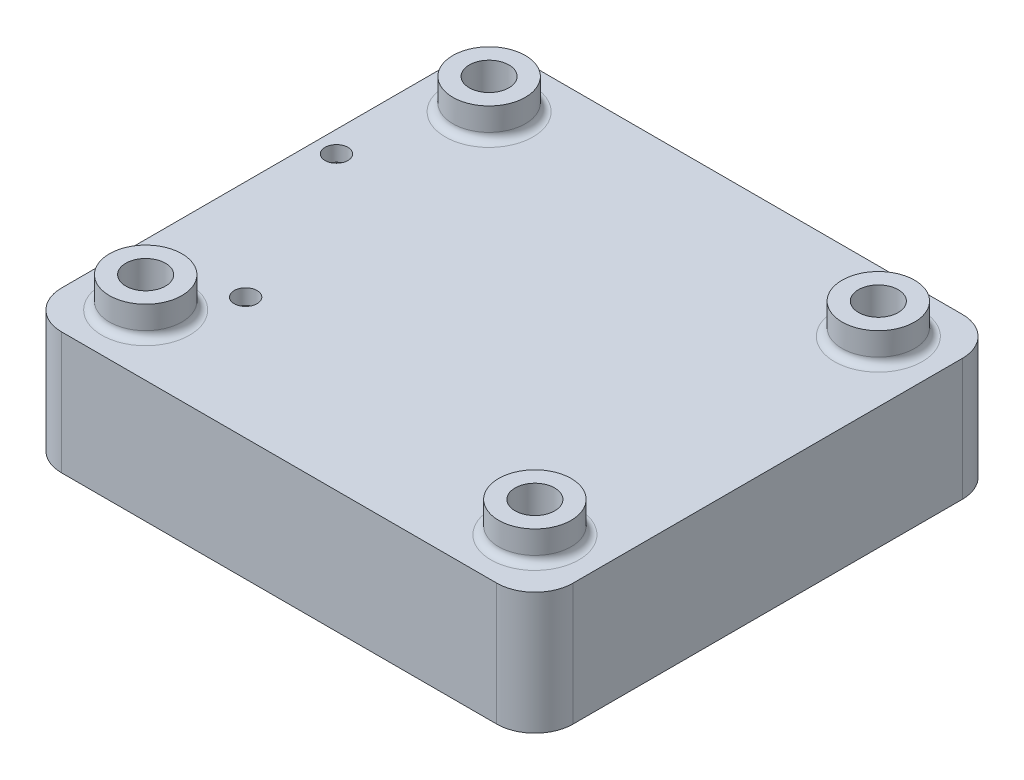
from build123d import *

# Parameters (mm, degrees)
ESQUISSE1_W             = 67
ESQUISSE1_H             = 61
BOSS_EXTRU_1_DEPTH      = 16
ESQUISSE4_R             = 4.75
BOSS_EXTRU_3_DEPTH      = 4
ESQUISSE6_R             = 2.6
ENL_V_MAT_EXTRU_2_DEPTH = 93.790085677
CONG_2_R                = 1
CONG_3_R                = 5
ENL_V_MAT_EXTRU_3_DEPTH = 14
ESQUISSE8_R             = 1.5
ENL_V_MAT_EXTRU_4_DEPTH = 11


with BuildPart() as part:
    # Esquisse1 → Boss.-Extru.1 (new body)
    with BuildSketch(Plane(origin=(0, 0, 0), x_dir=(1, 0, 0), z_dir=(0, 1, 0))):
        with Locations((33.5, 30.5)):
            Rectangle(ESQUISSE1_W, ESQUISSE1_H)
    extrude(amount=BOSS_EXTRU_1_DEPTH)

    # Esquisse4 → Boss.-Extru.3 (add)
    with BuildSketch(Plane(origin=(0, 16, 0), x_dir=(1, 0, 0), z_dir=(0, 1, 0))):
        with Locations((8, 8)):
            Circle(ESQUISSE4_R)
        with Locations((8, 53)):
            Circle(ESQUISSE4_R)
        with Locations((59, 8)):
            Circle(ESQUISSE4_R)
        with Locations((59, 53)):
            Circle(ESQUISSE4_R)
    extrude(amount=BOSS_EXTRU_3_DEPTH)

    # Esquisse6 → Enlèv. mat.-Extru.2 (cut, through all)
    with BuildSketch(Plane(origin=(0, 20, 0), x_dir=(1, 0, 0), z_dir=(0, 1, 0))):
        with Locations((8, 8)):
            Circle(ESQUISSE6_R)
        with Locations((8, 53)):
            Circle(ESQUISSE6_R)
        with Locations((59, 53)):
            Circle(ESQUISSE6_R)
        with Locations((59, 8)):
            Circle(ESQUISSE6_R)
    extrude(amount=-ENL_V_MAT_EXTRU_2_DEPTH, mode=Mode.SUBTRACT)

    # Congé2
    cong_2_edges = [part.edges().sort_by_distance(p)[0] for p in [
        (54.25, 16, -53),
        (3.25, 16, -53),
        (3.25, 16, -8),
        (54.25, 16, -8),
    ]]
    fillet(cong_2_edges, radius=CONG_2_R)

    # Congé3
    cong_3_edges = [part.edges().sort_by_distance(p)[0] for p in [
        (0, 8, -61),
        (0, 8, 0),
        (67, 8, 0),
        (67, 8, -61),
    ]]
    fillet(cong_3_edges, radius=CONG_3_R)

    # Esquisse7 → Enlèv. mat.-Extru.3 (cut)
    with BuildSketch(Plane.XZ):
        Polygon((0, -13), (0, -41), (6.5, -41), (6.5, -47), (14.5, -47), (14.5, -61), (22, -61), (22, -13), align=None)
    extrude(amount=-ENL_V_MAT_EXTRU_3_DEPTH, mode=Mode.SUBTRACT)

    # Esquisse8 → Enlèv. mat.-Extru.4 (cut)
    with BuildSketch(Plane(origin=(0, 14, 0), x_dir=(-1, 0, 0), z_dir=(0, -1, 0))):
        with Locations((-2.8, 38.2)):
            Circle(ESQUISSE8_R)
        with Locations((-13.1, 16)):
            Circle(ESQUISSE8_R)
    extrude(amount=-ENL_V_MAT_EXTRU_4_DEPTH, mode=Mode.SUBTRACT)


solid = part.part
